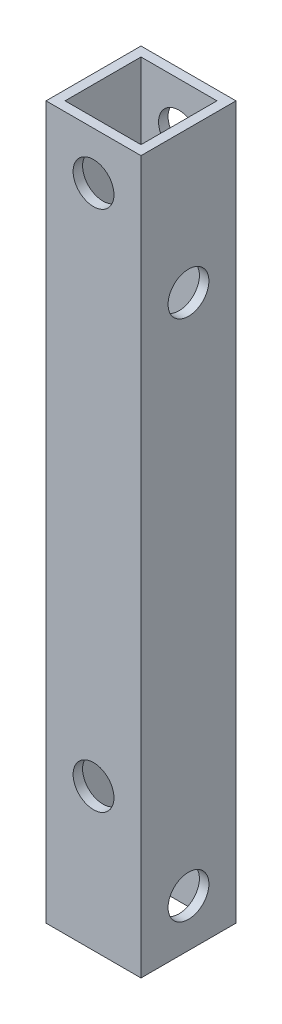
from build123d import *

# Parameters (mm, degrees)
SKETCH_1_W          = 10
SKETCH_1_H          = 10
SKETCH_1_W_2        = 8
SKETCH_1_H_2        = 8
EXTRUDE_1_DEPTH     = 75
SKETCH_2_R          = 2.15
CUT_EXTRUDE_1_DEPTH = 76.828754441
SKETCH_3_R          = 2.15
CUT_EXTRUDE_2_DEPTH = 76.828754441


with BuildPart() as part:
    # ｽｹｯﾁ1 → 押し出し-薄板1 (new body)
    with BuildSketch(Plane(origin=(0, 0, 0), x_dir=(1, 0, 0), z_dir=(0, 1, 0))):
        Rectangle(SKETCH_1_W, SKETCH_1_H)
        Rectangle(SKETCH_1_W_2, SKETCH_1_H_2, mode=Mode.SUBTRACT)
    extrude(amount=EXTRUDE_1_DEPTH)

    # ｽｹｯﾁ2 → ｶｯﾄ - 押し出し1 (cut, through all)
    with BuildSketch(Plane(origin=(5, 0, 0), x_dir=(0, 0, -1), z_dir=(1, 0, 0))):
        with Locations((0, 5)):
            Circle(SKETCH_2_R)
        with Locations((0, 60)):
            Circle(SKETCH_2_R)
    extrude(amount=-CUT_EXTRUDE_1_DEPTH, mode=Mode.SUBTRACT)

    # ｽｹｯﾁ3 → ｶｯﾄ - 押し出し2 (cut, through all)
    with BuildSketch(Plane.XY.offset(5)):
        with Locations((0, 15)):
            Circle(SKETCH_3_R)
        with Locations((0, 70)):
            Circle(SKETCH_3_R)
    extrude(amount=-CUT_EXTRUDE_2_DEPTH, mode=Mode.SUBTRACT)


solid = part.part
